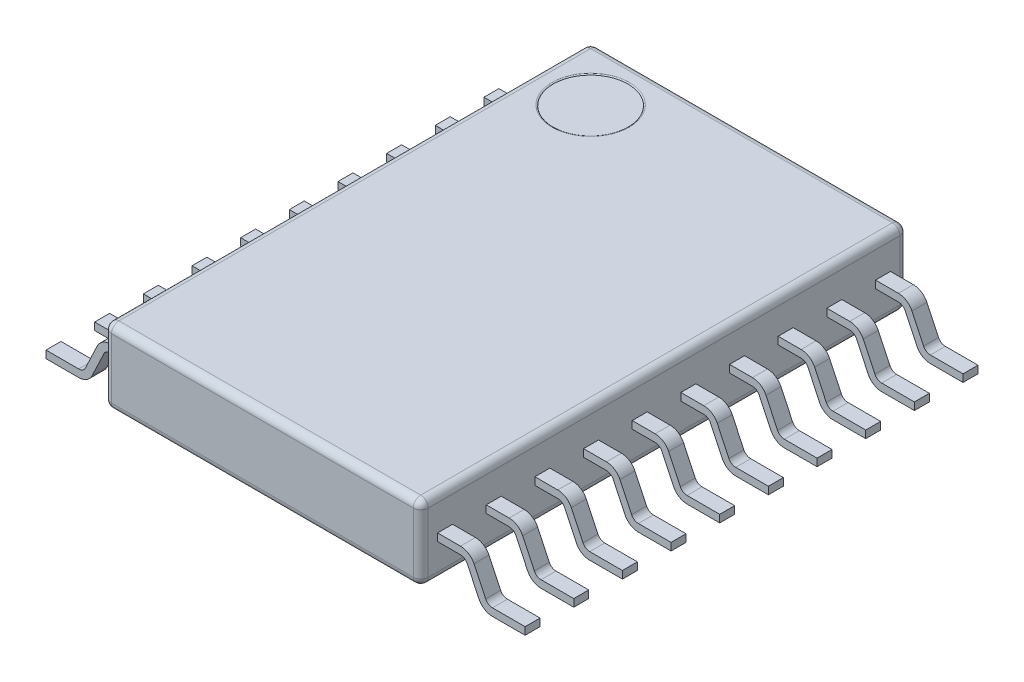
from build123d import *

# Parameters (mm, degrees)
BOSS_EXTRUDE2_DEPTH = 0.2
SKETCH2_W           = 4.230890159
SKETCH2_H           = 6.5
BOSS_EXTRUDE3_DEPTH = 1
LPATTERN2_START     = -6.05
LPATTERN2_DEPTH     = 0.2
LPATTERN2_START_2   = -5.4
LPATTERN2_2_DEPTH   = 0.2
LPATTERN2_START_3   = -4.75
LPATTERN2_3_DEPTH   = 0.2
LPATTERN2_START_4   = -4.1
LPATTERN2_4_DEPTH   = 0.2
LPATTERN2_START_5   = -3.45
LPATTERN2_5_DEPTH   = 0.2
LPATTERN2_START_6   = -2.8
LPATTERN2_6_DEPTH   = 0.2
LPATTERN2_START_7   = -2.15
LPATTERN2_7_DEPTH   = 0.2
LPATTERN2_START_8   = -1.5
LPATTERN2_8_DEPTH   = 0.2
LPATTERN2_START_9   = -0.85
LPATTERN2_9_DEPTH   = 0.2
FILLET1_R           = 0.1
FILLET2_R           = 0.1
SKETCH3_R           = 0.5
CUT_EXTRUDE1_DEPTH  = 0.01
FILLET3_R           = 0.02


# Read off the part's stored shape, not the designer's step: LPattern2
with BuildPart() as part:
    # Sketch1 → Boss-Extrude2 (new body)
    with BuildSketch(Plane.XY):
        with BuildLine():
            Line((0, 0), (-0.436700684, 0))
            ThreePointArc((-0.436700684, 0), (-0.543670068, 0.031010205), (-0.617468027, 0.114424492))
            Line((-0.617468027, 0.114424492), (-0.772915644, 0.442787754))
            ThreePointArc((-0.772915644, 0.442787754), (-0.809814624, 0.484494897), (-0.863299316, 0.5))
            Line((-0.863299316, 0.5), (-5.536700684, 0.5))
            ThreePointArc((-5.536700684, 0.5), (-5.590185376, 0.484494897), (-5.627084356, 0.442787754))
            Line((-5.627084356, 0.442787754), (-5.782531973, 0.114424492))
            ThreePointArc((-5.782531973, 0.114424492), (-5.856329932, 0.031010205), (-5.963299316, 0))
            Line((-5.963299316, 0), (-6.4, 0))
            Line((-6.4, 0), (-6.4, 0.1))
            Line((-6.4, 0.1), (-5.963299316, 0.1))
            ThreePointArc((-5.963299316, 0.1), (-5.909814624, 0.115505103), (-5.872915644, 0.157212246))
            Line((-5.872915644, 0.157212246), (-5.717468027, 0.485575508))
            ThreePointArc((-5.717468027, 0.485575508), (-5.643670068, 0.568989795), (-5.536700684, 0.6))
            Line((-5.536700684, 0.6), (-0.863299316, 0.6))
            ThreePointArc((-0.863299316, 0.6), (-0.756329932, 0.568989795), (-0.682531973, 0.485575508))
            Line((-0.682531973, 0.485575508), (-0.527084356, 0.157212246))
            ThreePointArc((-0.527084356, 0.157212246), (-0.490185376, 0.115505103), (-0.436700684, 0.1))
            Line((-0.436700684, 0.1), (0, 0.1))
            Line((0, 0.1), (0, 0))
        make_face()
    extrude(amount=-BOSS_EXTRUDE2_DEPTH)

    # Sketch2 → Boss-Extrude3 (add)
    with BuildSketch(Plane(origin=(0, 0.05, 0), x_dir=(1, 0, 0), z_dir=(0, 1, 0))):
        with Locations((-3.284554921, 3.025)):
            Rectangle(SKETCH2_W, SKETCH2_H)
    extrude(amount=BOSS_EXTRUDE3_DEPTH)

    # LPattern2 outline → LPattern2 (add)
    with BuildSketch(Plane.XY.offset(LPATTERN2_START)):
        with BuildLine():
            Line((-5.536700684, 0.5), (-5.4, 0.5))
            Line((-5.4, 0.5), (-5.4, 0.6))
            Line((-5.4, 0.6), (-5.536700684, 0.6))
            ThreePointArc((-5.536700684, 0.6), (-5.643670068, 0.568989795), (-5.717468027, 0.485575508))
            Line((-5.717468027, 0.485575508), (-5.872915644, 0.157212246))
            ThreePointArc((-5.872915644, 0.157212246), (-5.909814624, 0.115505103), (-5.963299316, 0.1))
            Line((-5.963299316, 0.1), (-6.4, 0.1))
            Line((-6.4, 0.1), (-6.4, 0))
            Line((-6.4, 0), (-5.963299316, 0))
            ThreePointArc((-5.963299316, 0), (-5.856329932, 0.031010205), (-5.782531973, 0.114424492))
            Line((-5.782531973, 0.114424492), (-5.627084356, 0.442787754))
            ThreePointArc((-5.627084356, 0.442787754), (-5.590185376, 0.484494897), (-5.536700684, 0.5))
        make_face()
        with BuildLine():
            Line((-1.169109841, 0.5), (-0.863299316, 0.5))
            ThreePointArc((-0.863299316, 0.5), (-0.809814624, 0.484494897), (-0.772915644, 0.442787754))
            Line((-0.772915644, 0.442787754), (-0.617468027, 0.114424492))
            ThreePointArc((-0.617468027, 0.114424492), (-0.543670068, 0.031010205), (-0.436700684, 0))
            Line((-0.436700684, 0), (0, 0))
            Line((0, 0), (0, 0.1))
            Line((0, 0.1), (-0.436700684, 0.1))
            ThreePointArc((-0.436700684, 0.1), (-0.490185376, 0.115505103), (-0.527084356, 0.157212246))
            Line((-0.527084356, 0.157212246), (-0.682531973, 0.485575508))
            ThreePointArc((-0.682531973, 0.485575508), (-0.756329932, 0.568989795), (-0.863299316, 0.6))
            Line((-0.863299316, 0.6), (-1.169109841, 0.6))
            Line((-1.169109841, 0.6), (-1.169109841, 0.5))
        make_face()
    extrude(amount=LPATTERN2_DEPTH)

    # LPattern2 2 outline → LPattern2 2 (add)
    with BuildSketch(Plane.XY.offset(LPATTERN2_START_2)):
        with BuildLine():
            Line((-5.536700684, 0.5), (-5.4, 0.5))
            Line((-5.4, 0.5), (-5.4, 0.6))
            Line((-5.4, 0.6), (-5.536700684, 0.6))
            ThreePointArc((-5.536700684, 0.6), (-5.643670068, 0.568989795), (-5.717468027, 0.485575508))
            Line((-5.717468027, 0.485575508), (-5.872915644, 0.157212246))
            ThreePointArc((-5.872915644, 0.157212246), (-5.909814624, 0.115505103), (-5.963299316, 0.1))
            Line((-5.963299316, 0.1), (-6.4, 0.1))
            Line((-6.4, 0.1), (-6.4, 0))
            Line((-6.4, 0), (-5.963299316, 0))
            ThreePointArc((-5.963299316, 0), (-5.856329932, 0.031010205), (-5.782531973, 0.114424492))
            Line((-5.782531973, 0.114424492), (-5.627084356, 0.442787754))
            ThreePointArc((-5.627084356, 0.442787754), (-5.590185376, 0.484494897), (-5.536700684, 0.5))
        make_face()
        with BuildLine():
            Line((-1.169109841, 0.5), (-0.863299316, 0.5))
            ThreePointArc((-0.863299316, 0.5), (-0.809814624, 0.484494897), (-0.772915644, 0.442787754))
            Line((-0.772915644, 0.442787754), (-0.617468027, 0.114424492))
            ThreePointArc((-0.617468027, 0.114424492), (-0.543670068, 0.031010205), (-0.436700684, 0))
            Line((-0.436700684, 0), (0, 0))
            Line((0, 0), (0, 0.1))
            Line((0, 0.1), (-0.436700684, 0.1))
            ThreePointArc((-0.436700684, 0.1), (-0.490185376, 0.115505103), (-0.527084356, 0.157212246))
            Line((-0.527084356, 0.157212246), (-0.682531973, 0.485575508))
            ThreePointArc((-0.682531973, 0.485575508), (-0.756329932, 0.568989795), (-0.863299316, 0.6))
            Line((-0.863299316, 0.6), (-1.169109841, 0.6))
            Line((-1.169109841, 0.6), (-1.169109841, 0.5))
        make_face()
    extrude(amount=LPATTERN2_2_DEPTH)

    # LPattern2 3 outline → LPattern2 3 (add)
    with BuildSketch(Plane.XY.offset(LPATTERN2_START_3)):
        with BuildLine():
            Line((-5.536700684, 0.5), (-5.4, 0.5))
            Line((-5.4, 0.5), (-5.4, 0.6))
            Line((-5.4, 0.6), (-5.536700684, 0.6))
            ThreePointArc((-5.536700684, 0.6), (-5.643670068, 0.568989795), (-5.717468027, 0.485575508))
            Line((-5.717468027, 0.485575508), (-5.872915644, 0.157212246))
            ThreePointArc((-5.872915644, 0.157212246), (-5.909814624, 0.115505103), (-5.963299316, 0.1))
            Line((-5.963299316, 0.1), (-6.4, 0.1))
            Line((-6.4, 0.1), (-6.4, 0))
            Line((-6.4, 0), (-5.963299316, 0))
            ThreePointArc((-5.963299316, 0), (-5.856329932, 0.031010205), (-5.782531973, 0.114424492))
            Line((-5.782531973, 0.114424492), (-5.627084356, 0.442787754))
            ThreePointArc((-5.627084356, 0.442787754), (-5.590185376, 0.484494897), (-5.536700684, 0.5))
        make_face()
        with BuildLine():
            Line((-1.169109841, 0.5), (-0.863299316, 0.5))
            ThreePointArc((-0.863299316, 0.5), (-0.809814624, 0.484494897), (-0.772915644, 0.442787754))
            Line((-0.772915644, 0.442787754), (-0.617468027, 0.114424492))
            ThreePointArc((-0.617468027, 0.114424492), (-0.543670068, 0.031010205), (-0.436700684, 0))
            Line((-0.436700684, 0), (0, 0))
            Line((0, 0), (0, 0.1))
            Line((0, 0.1), (-0.436700684, 0.1))
            ThreePointArc((-0.436700684, 0.1), (-0.490185376, 0.115505103), (-0.527084356, 0.157212246))
            Line((-0.527084356, 0.157212246), (-0.682531973, 0.485575508))
            ThreePointArc((-0.682531973, 0.485575508), (-0.756329932, 0.568989795), (-0.863299316, 0.6))
            Line((-0.863299316, 0.6), (-1.169109841, 0.6))
            Line((-1.169109841, 0.6), (-1.169109841, 0.5))
        make_face()
    extrude(amount=LPATTERN2_3_DEPTH)

    # LPattern2 4 outline → LPattern2 4 (add)
    with BuildSketch(Plane.XY.offset(LPATTERN2_START_4)):
        with BuildLine():
            Line((-5.536700684, 0.5), (-5.4, 0.5))
            Line((-5.4, 0.5), (-5.4, 0.6))
            Line((-5.4, 0.6), (-5.536700684, 0.6))
            ThreePointArc((-5.536700684, 0.6), (-5.643670068, 0.568989795), (-5.717468027, 0.485575508))
            Line((-5.717468027, 0.485575508), (-5.872915644, 0.157212246))
            ThreePointArc((-5.872915644, 0.157212246), (-5.909814624, 0.115505103), (-5.963299316, 0.1))
            Line((-5.963299316, 0.1), (-6.4, 0.1))
            Line((-6.4, 0.1), (-6.4, 0))
            Line((-6.4, 0), (-5.963299316, 0))
            ThreePointArc((-5.963299316, 0), (-5.856329932, 0.031010205), (-5.782531973, 0.114424492))
            Line((-5.782531973, 0.114424492), (-5.627084356, 0.442787754))
            ThreePointArc((-5.627084356, 0.442787754), (-5.590185376, 0.484494897), (-5.536700684, 0.5))
        make_face()
        with BuildLine():
            Line((-1.169109841, 0.5), (-0.863299316, 0.5))
            ThreePointArc((-0.863299316, 0.5), (-0.809814624, 0.484494897), (-0.772915644, 0.442787754))
            Line((-0.772915644, 0.442787754), (-0.617468027, 0.114424492))
            ThreePointArc((-0.617468027, 0.114424492), (-0.543670068, 0.031010205), (-0.436700684, 0))
            Line((-0.436700684, 0), (0, 0))
            Line((0, 0), (0, 0.1))
            Line((0, 0.1), (-0.436700684, 0.1))
            ThreePointArc((-0.436700684, 0.1), (-0.490185376, 0.115505103), (-0.527084356, 0.157212246))
            Line((-0.527084356, 0.157212246), (-0.682531973, 0.485575508))
            ThreePointArc((-0.682531973, 0.485575508), (-0.756329932, 0.568989795), (-0.863299316, 0.6))
            Line((-0.863299316, 0.6), (-1.169109841, 0.6))
            Line((-1.169109841, 0.6), (-1.169109841, 0.5))
        make_face()
    extrude(amount=LPATTERN2_4_DEPTH)

    # LPattern2 5 outline → LPattern2 5 (add)
    with BuildSketch(Plane.XY.offset(LPATTERN2_START_5)):
        with BuildLine():
            Line((-5.536700684, 0.5), (-5.4, 0.5))
            Line((-5.4, 0.5), (-5.4, 0.6))
            Line((-5.4, 0.6), (-5.536700684, 0.6))
            ThreePointArc((-5.536700684, 0.6), (-5.643670068, 0.568989795), (-5.717468027, 0.485575508))
            Line((-5.717468027, 0.485575508), (-5.872915644, 0.157212246))
            ThreePointArc((-5.872915644, 0.157212246), (-5.909814624, 0.115505103), (-5.963299316, 0.1))
            Line((-5.963299316, 0.1), (-6.4, 0.1))
            Line((-6.4, 0.1), (-6.4, 0))
            Line((-6.4, 0), (-5.963299316, 0))
            ThreePointArc((-5.963299316, 0), (-5.856329932, 0.031010205), (-5.782531973, 0.114424492))
            Line((-5.782531973, 0.114424492), (-5.627084356, 0.442787754))
            ThreePointArc((-5.627084356, 0.442787754), (-5.590185376, 0.484494897), (-5.536700684, 0.5))
        make_face()
        with BuildLine():
            Line((-1.169109841, 0.5), (-0.863299316, 0.5))
            ThreePointArc((-0.863299316, 0.5), (-0.809814624, 0.484494897), (-0.772915644, 0.442787754))
            Line((-0.772915644, 0.442787754), (-0.617468027, 0.114424492))
            ThreePointArc((-0.617468027, 0.114424492), (-0.543670068, 0.031010205), (-0.436700684, 0))
            Line((-0.436700684, 0), (0, 0))
            Line((0, 0), (0, 0.1))
            Line((0, 0.1), (-0.436700684, 0.1))
            ThreePointArc((-0.436700684, 0.1), (-0.490185376, 0.115505103), (-0.527084356, 0.157212246))
            Line((-0.527084356, 0.157212246), (-0.682531973, 0.485575508))
            ThreePointArc((-0.682531973, 0.485575508), (-0.756329932, 0.568989795), (-0.863299316, 0.6))
            Line((-0.863299316, 0.6), (-1.169109841, 0.6))
            Line((-1.169109841, 0.6), (-1.169109841, 0.5))
        make_face()
    extrude(amount=LPATTERN2_5_DEPTH)

    # LPattern2 6 outline → LPattern2 6 (add)
    with BuildSketch(Plane.XY.offset(LPATTERN2_START_6)):
        with BuildLine():
            Line((-5.536700684, 0.5), (-5.4, 0.5))
            Line((-5.4, 0.5), (-5.4, 0.6))
            Line((-5.4, 0.6), (-5.536700684, 0.6))
            ThreePointArc((-5.536700684, 0.6), (-5.643670068, 0.568989795), (-5.717468027, 0.485575508))
            Line((-5.717468027, 0.485575508), (-5.872915644, 0.157212246))
            ThreePointArc((-5.872915644, 0.157212246), (-5.909814624, 0.115505103), (-5.963299316, 0.1))
            Line((-5.963299316, 0.1), (-6.4, 0.1))
            Line((-6.4, 0.1), (-6.4, 0))
            Line((-6.4, 0), (-5.963299316, 0))
            ThreePointArc((-5.963299316, 0), (-5.856329932, 0.031010205), (-5.782531973, 0.114424492))
            Line((-5.782531973, 0.114424492), (-5.627084356, 0.442787754))
            ThreePointArc((-5.627084356, 0.442787754), (-5.590185376, 0.484494897), (-5.536700684, 0.5))
        make_face()
        with BuildLine():
            Line((-1.169109841, 0.5), (-0.863299316, 0.5))
            ThreePointArc((-0.863299316, 0.5), (-0.809814624, 0.484494897), (-0.772915644, 0.442787754))
            Line((-0.772915644, 0.442787754), (-0.617468027, 0.114424492))
            ThreePointArc((-0.617468027, 0.114424492), (-0.543670068, 0.031010205), (-0.436700684, 0))
            Line((-0.436700684, 0), (0, 0))
            Line((0, 0), (0, 0.1))
            Line((0, 0.1), (-0.436700684, 0.1))
            ThreePointArc((-0.436700684, 0.1), (-0.490185376, 0.115505103), (-0.527084356, 0.157212246))
            Line((-0.527084356, 0.157212246), (-0.682531973, 0.485575508))
            ThreePointArc((-0.682531973, 0.485575508), (-0.756329932, 0.568989795), (-0.863299316, 0.6))
            Line((-0.863299316, 0.6), (-1.169109841, 0.6))
            Line((-1.169109841, 0.6), (-1.169109841, 0.5))
        make_face()
    extrude(amount=LPATTERN2_6_DEPTH)

    # LPattern2 7 outline → LPattern2 7 (add)
    with BuildSketch(Plane.XY.offset(LPATTERN2_START_7)):
        with BuildLine():
            Line((-5.536700684, 0.5), (-5.4, 0.5))
            Line((-5.4, 0.5), (-5.4, 0.6))
            Line((-5.4, 0.6), (-5.536700684, 0.6))
            ThreePointArc((-5.536700684, 0.6), (-5.643670068, 0.568989795), (-5.717468027, 0.485575508))
            Line((-5.717468027, 0.485575508), (-5.872915644, 0.157212246))
            ThreePointArc((-5.872915644, 0.157212246), (-5.909814624, 0.115505103), (-5.963299316, 0.1))
            Line((-5.963299316, 0.1), (-6.4, 0.1))
            Line((-6.4, 0.1), (-6.4, 0))
            Line((-6.4, 0), (-5.963299316, 0))
            ThreePointArc((-5.963299316, 0), (-5.856329932, 0.031010205), (-5.782531973, 0.114424492))
            Line((-5.782531973, 0.114424492), (-5.627084356, 0.442787754))
            ThreePointArc((-5.627084356, 0.442787754), (-5.590185376, 0.484494897), (-5.536700684, 0.5))
        make_face()
        with BuildLine():
            Line((-1.169109841, 0.5), (-0.863299316, 0.5))
            ThreePointArc((-0.863299316, 0.5), (-0.809814624, 0.484494897), (-0.772915644, 0.442787754))
            Line((-0.772915644, 0.442787754), (-0.617468027, 0.114424492))
            ThreePointArc((-0.617468027, 0.114424492), (-0.543670068, 0.031010205), (-0.436700684, 0))
            Line((-0.436700684, 0), (0, 0))
            Line((0, 0), (0, 0.1))
            Line((0, 0.1), (-0.436700684, 0.1))
            ThreePointArc((-0.436700684, 0.1), (-0.490185376, 0.115505103), (-0.527084356, 0.157212246))
            Line((-0.527084356, 0.157212246), (-0.682531973, 0.485575508))
            ThreePointArc((-0.682531973, 0.485575508), (-0.756329932, 0.568989795), (-0.863299316, 0.6))
            Line((-0.863299316, 0.6), (-1.169109841, 0.6))
            Line((-1.169109841, 0.6), (-1.169109841, 0.5))
        make_face()
    extrude(amount=LPATTERN2_7_DEPTH)

    # LPattern2 8 outline → LPattern2 8 (add)
    with BuildSketch(Plane.XY.offset(LPATTERN2_START_8)):
        with BuildLine():
            Line((-5.536700684, 0.5), (-5.4, 0.5))
            Line((-5.4, 0.5), (-5.4, 0.6))
            Line((-5.4, 0.6), (-5.536700684, 0.6))
            ThreePointArc((-5.536700684, 0.6), (-5.643670068, 0.568989795), (-5.717468027, 0.485575508))
            Line((-5.717468027, 0.485575508), (-5.872915644, 0.157212246))
            ThreePointArc((-5.872915644, 0.157212246), (-5.909814624, 0.115505103), (-5.963299316, 0.1))
            Line((-5.963299316, 0.1), (-6.4, 0.1))
            Line((-6.4, 0.1), (-6.4, 0))
            Line((-6.4, 0), (-5.963299316, 0))
            ThreePointArc((-5.963299316, 0), (-5.856329932, 0.031010205), (-5.782531973, 0.114424492))
            Line((-5.782531973, 0.114424492), (-5.627084356, 0.442787754))
            ThreePointArc((-5.627084356, 0.442787754), (-5.590185376, 0.484494897), (-5.536700684, 0.5))
        make_face()
        with BuildLine():
            Line((-1.169109841, 0.5), (-0.863299316, 0.5))
            ThreePointArc((-0.863299316, 0.5), (-0.809814624, 0.484494897), (-0.772915644, 0.442787754))
            Line((-0.772915644, 0.442787754), (-0.617468027, 0.114424492))
            ThreePointArc((-0.617468027, 0.114424492), (-0.543670068, 0.031010205), (-0.436700684, 0))
            Line((-0.436700684, 0), (0, 0))
            Line((0, 0), (0, 0.1))
            Line((0, 0.1), (-0.436700684, 0.1))
            ThreePointArc((-0.436700684, 0.1), (-0.490185376, 0.115505103), (-0.527084356, 0.157212246))
            Line((-0.527084356, 0.157212246), (-0.682531973, 0.485575508))
            ThreePointArc((-0.682531973, 0.485575508), (-0.756329932, 0.568989795), (-0.863299316, 0.6))
            Line((-0.863299316, 0.6), (-1.169109841, 0.6))
            Line((-1.169109841, 0.6), (-1.169109841, 0.5))
        make_face()
    extrude(amount=LPATTERN2_8_DEPTH)

    # LPattern2 9 outline → LPattern2 9 (add)
    with BuildSketch(Plane.XY.offset(LPATTERN2_START_9)):
        with BuildLine():
            Line((-5.536700684, 0.5), (-5.4, 0.5))
            Line((-5.4, 0.5), (-5.4, 0.6))
            Line((-5.4, 0.6), (-5.536700684, 0.6))
            ThreePointArc((-5.536700684, 0.6), (-5.643670068, 0.568989795), (-5.717468027, 0.485575508))
            Line((-5.717468027, 0.485575508), (-5.872915644, 0.157212246))
            ThreePointArc((-5.872915644, 0.157212246), (-5.909814624, 0.115505103), (-5.963299316, 0.1))
            Line((-5.963299316, 0.1), (-6.4, 0.1))
            Line((-6.4, 0.1), (-6.4, 0))
            Line((-6.4, 0), (-5.963299316, 0))
            ThreePointArc((-5.963299316, 0), (-5.856329932, 0.031010205), (-5.782531973, 0.114424492))
            Line((-5.782531973, 0.114424492), (-5.627084356, 0.442787754))
            ThreePointArc((-5.627084356, 0.442787754), (-5.590185376, 0.484494897), (-5.536700684, 0.5))
        make_face()
        with BuildLine():
            Line((-1.169109841, 0.5), (-0.863299316, 0.5))
            ThreePointArc((-0.863299316, 0.5), (-0.809814624, 0.484494897), (-0.772915644, 0.442787754))
            Line((-0.772915644, 0.442787754), (-0.617468027, 0.114424492))
            ThreePointArc((-0.617468027, 0.114424492), (-0.543670068, 0.031010205), (-0.436700684, 0))
            Line((-0.436700684, 0), (0, 0))
            Line((0, 0), (0, 0.1))
            Line((0, 0.1), (-0.436700684, 0.1))
            ThreePointArc((-0.436700684, 0.1), (-0.490185376, 0.115505103), (-0.527084356, 0.157212246))
            Line((-0.527084356, 0.157212246), (-0.682531973, 0.485575508))
            ThreePointArc((-0.682531973, 0.485575508), (-0.756329932, 0.568989795), (-0.863299316, 0.6))
            Line((-0.863299316, 0.6), (-1.169109841, 0.6))
            Line((-1.169109841, 0.6), (-1.169109841, 0.5))
        make_face()
    extrude(amount=LPATTERN2_9_DEPTH)

    # Fillet1
    fillet1_edges = [part.edges().sort_by_distance(p)[0] for p in [
        (-3.28455492, 0.05, 0.225),
        (-1.169109841, 0.05, -3.025),
        (-3.28455492, 1.05, -6.275),
        (-5.4, 1.05, -3.025),
        (-3.28455492, 1.05, 0.225),
        (-1.169109841, 1.05, -3.025),
        (-5.4, 0.05, -3.025),
        (-3.28455492, 0.05, -6.275),
    ]]
    fillet(fillet1_edges, radius=FILLET1_R)

    # Fillet2
    # the kernel refuses this fillet: 0.1 mm, written as the material it takes off along each edge
    with BuildSketch(Plane(origin=(-5.3, 0.15, 0.125), x_dir=(0, 0, 1), z_dir=(-1, 0, 0))) as fillet2_piece_1_section:
        Polygon((0, 0), (FILLET2_R, 0), (FILLET2_R, -FILLET2_R), (0, -FILLET2_R), align=None)
    fillet2_piece_1 = extrude(amount=FILLET2_R, mode=Mode.PRIVATE)
    fillet2_piece_1 = fillet2_piece_1 - Plane(origin=(-5.3, 0.15, 0.125), x_dir=(0, 0.7071067811865475, -0.7071067811865475), z_dir=(-1, 0, 0)) * Sphere(FILLET2_R, mode=Mode.PRIVATE)
    add(fillet2_piece_1, mode=Mode.SUBTRACT)
    with BuildSketch(Plane(origin=(-5.3, 0.15, -6.175), x_dir=(0, 0, -1), z_dir=(-1, 0, 0))) as fillet2_piece_2_section:
        Polygon((0, 0), (FILLET2_R, 0), (FILLET2_R, FILLET2_R), (0, FILLET2_R), align=None)
    fillet2_piece_2 = extrude(amount=FILLET2_R, mode=Mode.PRIVATE)
    fillet2_piece_2 = fillet2_piece_2 - Plane(origin=(-5.3, 0.15, -6.175), x_dir=(0, 0.7071067811865475, 0.7071067811865475), z_dir=(-1, 0, 0)) * Sphere(FILLET2_R, mode=Mode.PRIVATE)
    add(fillet2_piece_2, mode=Mode.SUBTRACT)
    with BuildSketch(Plane(origin=(-1.269109841, 0.15, 0.125), x_dir=(1, 0, 0), z_dir=(0, 0, 1))) as fillet2_piece_3_section:
        Polygon((0, 0), (FILLET2_R, 0), (FILLET2_R, -FILLET2_R), (0, -FILLET2_R), align=None)
    fillet2_piece_3 = extrude(amount=FILLET2_R, mode=Mode.PRIVATE)
    fillet2_piece_3 = fillet2_piece_3 - Plane(origin=(-1.269109841, 0.15, 0.125), x_dir=(-0.7071067811865475, 0.7071067811865475, 0), z_dir=(0, 0, 1)) * Sphere(FILLET2_R, mode=Mode.PRIVATE)
    add(fillet2_piece_3, mode=Mode.SUBTRACT)
    with BuildSketch(Plane(origin=(-1.269109841, 0.15, -6.175), x_dir=(1, 0, 0), z_dir=(0, 0, -1))) as fillet2_piece_4_section:
        Polygon((0, 0), (FILLET2_R, 0), (FILLET2_R, FILLET2_R), (0, FILLET2_R), align=None)
    fillet2_piece_4 = extrude(amount=FILLET2_R, mode=Mode.PRIVATE)
    fillet2_piece_4 = fillet2_piece_4 - Plane(origin=(-1.269109841, 0.15, -6.175), x_dir=(-0.7071067811865475, 0.7071067811865475, 0), z_dir=(0, 0, -1)) * Sphere(FILLET2_R, mode=Mode.PRIVATE)
    add(fillet2_piece_4, mode=Mode.SUBTRACT)
    with BuildSketch(Plane(origin=(-5.3, 0.95, 0.125), x_dir=(0, 0, 1), z_dir=(-1, 0, 0))) as fillet2_piece_5_section:
        Polygon((0, 0), (FILLET2_R, 0), (FILLET2_R, FILLET2_R), (0, FILLET2_R), align=None)
    fillet2_piece_5 = extrude(amount=FILLET2_R, mode=Mode.PRIVATE)
    fillet2_piece_5 = fillet2_piece_5 - Plane(origin=(-5.3, 0.95, 0.125), x_dir=(0, -0.7071067811865475, -0.7071067811865475), z_dir=(-1, 0, 0)) * Sphere(FILLET2_R, mode=Mode.PRIVATE)
    add(fillet2_piece_5, mode=Mode.SUBTRACT)
    with BuildSketch(Plane(origin=(-1.269109841, 0.95, 0.125), x_dir=(1, 0, 0), z_dir=(0, 0, 1))) as fillet2_piece_6_section:
        Polygon((0, 0), (FILLET2_R, 0), (FILLET2_R, FILLET2_R), (0, FILLET2_R), align=None)
    fillet2_piece_6 = extrude(amount=FILLET2_R, mode=Mode.PRIVATE)
    fillet2_piece_6 = fillet2_piece_6 - Plane(origin=(-1.269109841, 0.95, 0.125), x_dir=(-0.7071067811865475, -0.7071067811865475, 0), z_dir=(0, 0, 1)) * Sphere(FILLET2_R, mode=Mode.PRIVATE)
    add(fillet2_piece_6, mode=Mode.SUBTRACT)
    with BuildSketch(Plane(origin=(-5.3, 0.95, -6.175), x_dir=(0, 0, -1), z_dir=(-1, 0, 0))) as fillet2_piece_7_section:
        Polygon((0, 0), (FILLET2_R, 0), (FILLET2_R, -FILLET2_R), (0, -FILLET2_R), align=None)
    fillet2_piece_7 = extrude(amount=FILLET2_R, mode=Mode.PRIVATE)
    fillet2_piece_7 = fillet2_piece_7 - Plane(origin=(-5.3, 0.95, -6.175), x_dir=(0, -0.7071067811865475, 0.7071067811865475), z_dir=(-1, 0, 0)) * Sphere(FILLET2_R, mode=Mode.PRIVATE)
    add(fillet2_piece_7, mode=Mode.SUBTRACT)
    with BuildSketch(Plane(origin=(-1.269109841, 0.95, -6.175), x_dir=(1, 0, 0), z_dir=(0, 0, -1))) as fillet2_piece_8_section:
        Polygon((0, 0), (FILLET2_R, 0), (FILLET2_R, -FILLET2_R), (0, -FILLET2_R), align=None)
    fillet2_piece_8 = extrude(amount=FILLET2_R, mode=Mode.PRIVATE)
    fillet2_piece_8 = fillet2_piece_8 - Plane(origin=(-1.269109841, 0.95, -6.175), x_dir=(-0.7071067811865475, -0.7071067811865475, 0), z_dir=(0, 0, -1)) * Sphere(FILLET2_R, mode=Mode.PRIVATE)
    add(fillet2_piece_8, mode=Mode.SUBTRACT)
    with BuildSketch(Plane(origin=(-1.169109841, 0.15, -6.275), x_dir=(-1, 0, 0), z_dir=(0, 1, 0)), Plane(origin=(-5.4, 0.15, -6.275), x_dir=(0, 0, 1), z_dir=(0, 1, 0))) as fillet2_piece_9:
        with BuildLine():
            CenterArc((FILLET2_R, FILLET2_R), FILLET2_R, 180, 90)
            Line((0, FILLET2_R), (0, 0))
            Line((0, 0), (FILLET2_R, 0))
        make_face()
    extrude(amount=0.8, mode=Mode.SUBTRACT)
    with BuildSketch(Plane(origin=(-1.169109841, 0.15, 0.225), x_dir=(-1, 0, 0), z_dir=(0, 1, 0)), Plane(origin=(-5.4, 0.15, 0.225), x_dir=(0, 0, -1), z_dir=(0, 1, 0))) as fillet2_piece_10:
        with BuildLine():
            CenterArc((FILLET2_R, -FILLET2_R), FILLET2_R, 90, 90)
            Line((0, -FILLET2_R), (0, 0))
            Line((0, 0), (FILLET2_R, 0))
        make_face()
    extrude(amount=0.8, mode=Mode.SUBTRACT)

    # Sketch3 → Cut-Extrude1 (cut)
    with BuildSketch(Plane(origin=(0, 1.05, 0), x_dir=(1, 0, 0), z_dir=(0, 1, 0))):
        with Locations(Location((-4.65, 5.525, 0), (0, 0, 270))):
            Circle(SKETCH3_R)
    extrude(amount=-CUT_EXTRUDE1_DEPTH, mode=Mode.SUBTRACT)

    # Fillet3
    # the kernel refuses this fillet: 0.02 mm, written as the material it takes off along each edge
    with BuildSketch(Plane(origin=(-4.65, 1.05, -5.525), x_dir=(0, 0, 1), z_dir=(-1, 0, 0))) as fillet3_piece_1:
        with BuildLine():
            CenterArc((0.517320508, -0.02), FILLET3_R, 90, 60)
            Line((0.5, -0.01), (0.49965359, -0.0098))
            ThreePointArc((0.49965359, -0.0098), (0.4996, -0.005), (0.4996, 0))
            Line((0.4996, 0), (0.5, 0.0004))
            Line((0.5, 0.0004), (0.517320508, 0.0004))
            Line((0.517320508, 0.0004), (0.517320508, 0))
        make_face()
    revolve(axis=Axis((-4.65, 1.05, -5.525), (0, 1, 0)), mode=Mode.SUBTRACT)


solid = part.part
